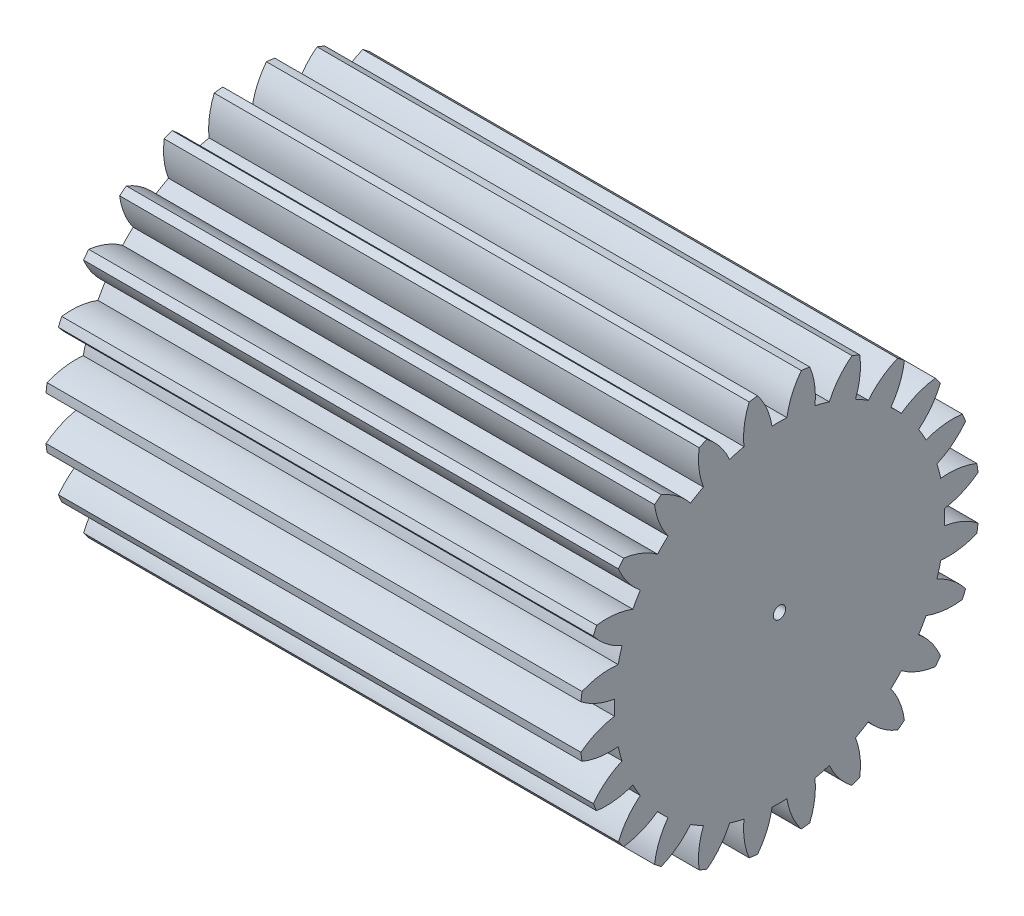
from build123d import *

# Parameters (mm, degrees)
BASPROSKE_W     = 34.815
BASPROSKE_H     = 13
TOOTHCUT_DEPTH  = 40.371109014
TEETHCUTS_COUNT = 24
TEETHCUTS_ANGLE = 345
BORSKE_R        = 0.4
BORE_DEPTH      = 50.0000508
SCALE1_SCALE    = 2


with BuildPart() as part:
    # BasProSke → Base-Revolve (revolve)
    with BuildSketch(Plane(origin=(0, 0, 0), x_dir=(1, 0, 0), z_dir=(0, 1, 0))):
        with Locations((17.4075, 6.5)):
            Rectangle(BASPROSKE_W, BASPROSKE_H)
    revolve(axis=Axis((-10, 0, 0), (1, 0, 0)))

    # TooCutSke → ToothCut (cut, through all)
    with BuildSketch(Plane(origin=(0, 0, 0), x_dir=(0, 0, -1), z_dir=(1, 0, 0))):
        with BuildLine():
            ThreePointArc((0.483448384, 10.738122679), (0, 10.749), (-0.483448384, 10.738122679))
            ThreePointArc((-0.483448384, 10.738122679), (-0.821636462, 11.902754369), (-1.44092227, 12.945454344))
            ThreePointArc((-1.44092227, 12.945454344), (0, 13.0254), (1.44092227, 12.945454344))
            ThreePointArc((1.44092227, 12.945454344), (0.821636462, 11.902754369), (0.483448384, 10.738122679))
        make_face()
    toothcut = extrude(amount=TOOTHCUT_DEPTH, mode=Mode.SUBTRACT)

    # TeethCuts: ToothCut ×24 about axis
    teethcuts_axis = Axis((-10, 0, 0), (1, 0, 0))
    for i in range(1, TEETHCUTS_COUNT):
        add(toothcut.rotate(teethcuts_axis, i * TEETHCUTS_ANGLE / (TEETHCUTS_COUNT - 1)), mode=Mode.SUBTRACT)

    # BorSke → Bore (cut, symmetric)
    with BuildSketch(Plane(origin=(0, 0, 0), x_dir=(0, 0, -1), z_dir=(1, 0, 0))):
        Circle(BORSKE_R)
    extrude(amount=BORE_DEPTH, both=True, mode=Mode.SUBTRACT)


with BuildPart() as part_1:
    # Scale1: scaled about (17.4075, 0, 0)
    add(part.part.scale(SCALE1_SCALE).moved(Location((-17.4075, 0, 0))))


solid = part_1.part
